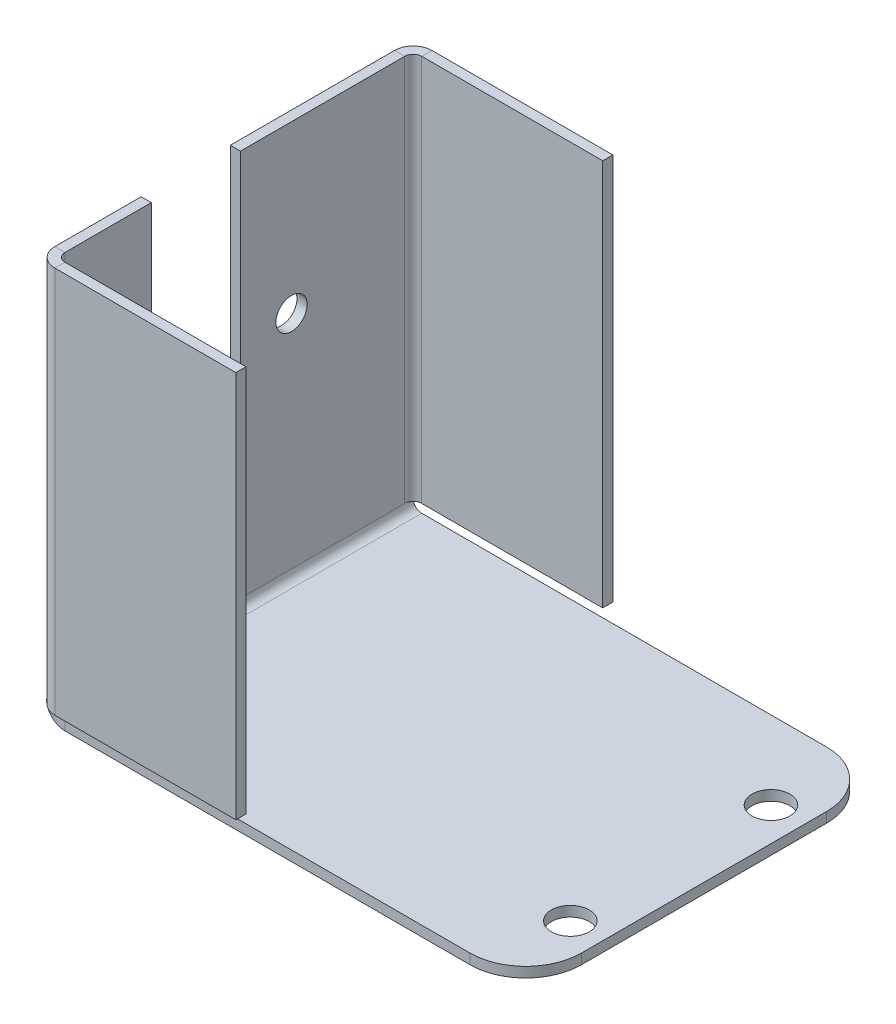
from build123d import *

# Parameters (mm, degrees)
SKETCH1_W                    = 43
SKETCH1_H                    = 32
BASE_FLANGE1_DEPTH           = 0.91
EDGE_FLANGE1_STRIP_W         = 5.164
EDGE_FLANGE1_STRIP_H         = 0.91
EDGE_FLANGE1_STRIP_CUT_DEPTH = 32
EDGE_FLANGE1_DEPTH           = 32
EDGE_FLANGE2_STRIP_W         = 5.164
EDGE_FLANGE2_STRIP_H         = 0.91
EDGE_FLANGE2_STRIP_CUT_DEPTH = 34.738
EDGE_FLANGE2_DEPTH           = 34.738
SKETCH9_R                    = 4
MOTOR_HOLES_DEPTH            = 0.91
M3_CLEARANCE_HOLE3_D         = 3.4
M3_CLEARANCE_HOLE3_DEPTH     = 12
M3_CLEARANCE_HOLE3_TIP       = 1.021463052
SKETCH31_W                   = 8
SKETCH31_H                   = 20.5
CUT_EXTRUDE3_DEPTH           = 10
FILLET2_R                    = 5
SKETCH34_R                   = 1.4
CUT_EXTRUDE4_DEPTH           = 10
SKETCH35_R                   = 1.4
CUT_EXTRUDE5_DEPTH           = 10


# Sheet-metal steps are written as plain solids
with BuildPart() as part:
    # Sketch1 → Base-Flange1 (new body)
    with BuildSketch(Plane(origin=(0, 0, 0), x_dir=(1, 0, 0), z_dir=(0, 1, 0))):
        with Locations((21.5, 16)):
            Rectangle(SKETCH1_W, SKETCH1_H)
    extrude(amount=-BASE_FLANGE1_DEPTH)

    # Edge-Flange1 strip (across the edge) → Edge-Flange1 strip cut (cut)
    with BuildSketch(Plane.XY.offset(-32)):
        with Locations((-0.91, -0.455)):
            Rectangle(EDGE_FLANGE1_STRIP_W, EDGE_FLANGE1_STRIP_H)
    extrude(amount=EDGE_FLANGE1_STRIP_CUT_DEPTH, mode=Mode.SUBTRACT)

    # Edge-Flange1 section (across the edge) → Edge-Flange1 (add)
    with BuildSketch(Plane.XY.offset(-32)):
        with BuildLine():
            Line((0, 0.762), (0, 35.5))
            Line((0, 35.5), (0.91, 35.5))
            Line((0.91, 35.5), (0.91, 0.762))
            ThreePointArc((0.91, 0.762), (1.133184633, 0.223184633), (1.672, 0))
            Line((1.672, 0), (1.672, -0.91))
            ThreePointArc((1.672, -0.91), (0.489717462, -0.420282538), (0, 0.762))
        make_face()
    extrude(amount=EDGE_FLANGE1_DEPTH)

    # Edge-Flange2 strip (across the edge) → Edge-Flange2 strip cut (cut)
    with BuildSketch(Plane(origin=(0.91, 35.5, 0), x_dir=(0, 0, -1), z_dir=(0, -1, 0))):
        with Locations((-1.82, -0.455)):
            Rectangle(EDGE_FLANGE2_STRIP_W, EDGE_FLANGE2_STRIP_H)
    edge_flange2_strip_cut = extrude(amount=EDGE_FLANGE2_STRIP_CUT_DEPTH, mode=Mode.SUBTRACT)

    # Edge-Flange2 section (across the edge) → Edge-Flange2 (add)
    with BuildSketch(Plane(origin=(0.91, 35.5, 0), x_dir=(0, 0, -1), z_dir=(0, -1, 0))):
        with BuildLine():
            Line((-0.91, 0.762), (-0.91, 17))
            Line((-0.91, 17), (0, 17))
            Line((0, 17), (0, 0.762))
            ThreePointArc((0, 0.762), (0.223184633, 0.223184633), (0.762, 0))
            Line((0.762, 0), (0.762, -0.91))
            ThreePointArc((0.762, -0.91), (-0.420282538, -0.420282538), (-0.91, 0.762))
        make_face()
    edge_flange2 = extrude(amount=EDGE_FLANGE2_DEPTH)

    # Sketch9 → Motor Holes (cut)
    with BuildSketch(Plane.ZY):
        with Locations(Location((-12.5, 15, 0), (0, 0, 270))):
            Circle(SKETCH9_R)
    extrude(amount=-MOTOR_HOLES_DEPTH, mode=Mode.SUBTRACT)

    # Mirror4: Edge-Flange2 strip cut, Edge-Flange2 across plane
    add(edge_flange2_strip_cut.mirror(Plane(origin=(0, 0, -16), x_dir=(1, 0, 0), z_dir=(0, 0, -1))), mode=Mode.SUBTRACT)
    add(edge_flange2.mirror(Plane(origin=(0, 0, -16), x_dir=(1, 0, 0), z_dir=(0, 0, -1))))

    # M3 Clearance Hole3
    with Locations(Plane(origin=(0, 0, 0), x_dir=(1, 0, 0), z_dir=(0, 1, 0))):
        with Locations((40, 7), (4.672, 3), (40, 25)):
            Hole(M3_CLEARANCE_HOLE3_D / 2, depth=M3_CLEARANCE_HOLE3_DEPTH)
            with Locations((0, 0, -(M3_CLEARANCE_HOLE3_DEPTH + M3_CLEARANCE_HOLE3_TIP / 2))):  # 118° drill point
                Cone(0, M3_CLEARANCE_HOLE3_D / 2, M3_CLEARANCE_HOLE3_TIP, mode=Mode.SUBTRACT)

    # Sketch31 → Cut-Extrude3 (cut)
    with BuildSketch(Plane.ZY):
        with Locations((-12.5, 25.25)):
            Rectangle(SKETCH31_W, SKETCH31_H)
    extrude(amount=-CUT_EXTRUDE3_DEPTH, mode=Mode.SUBTRACT)

    # Fillet2
    fillet2_edges = [part.edges().sort_by_distance(p)[0] for p in [
        (43, -0.455, -32),
        (43, -0.455, 0),
    ]]
    fillet(fillet2_edges, radius=FILLET2_R)

    # Sketch34 → Cut-Extrude4 (cut)
    with BuildSketch(Plane.ZY):
        with Locations(Location((-7.1, 7.23, 0), (0, 0, 270))):
            Circle(SKETCH34_R)
    extrude(amount=-CUT_EXTRUDE4_DEPTH, mode=Mode.SUBTRACT)

    # Sketch35 → Cut-Extrude5 (cut)
    with BuildSketch(Plane.ZY):
        with Locations(Location((-21.08, 20.6, 0), (0, 0, 270))):
            Circle(SKETCH35_R)
    extrude(amount=-CUT_EXTRUDE5_DEPTH, mode=Mode.SUBTRACT)


solid = part.part
